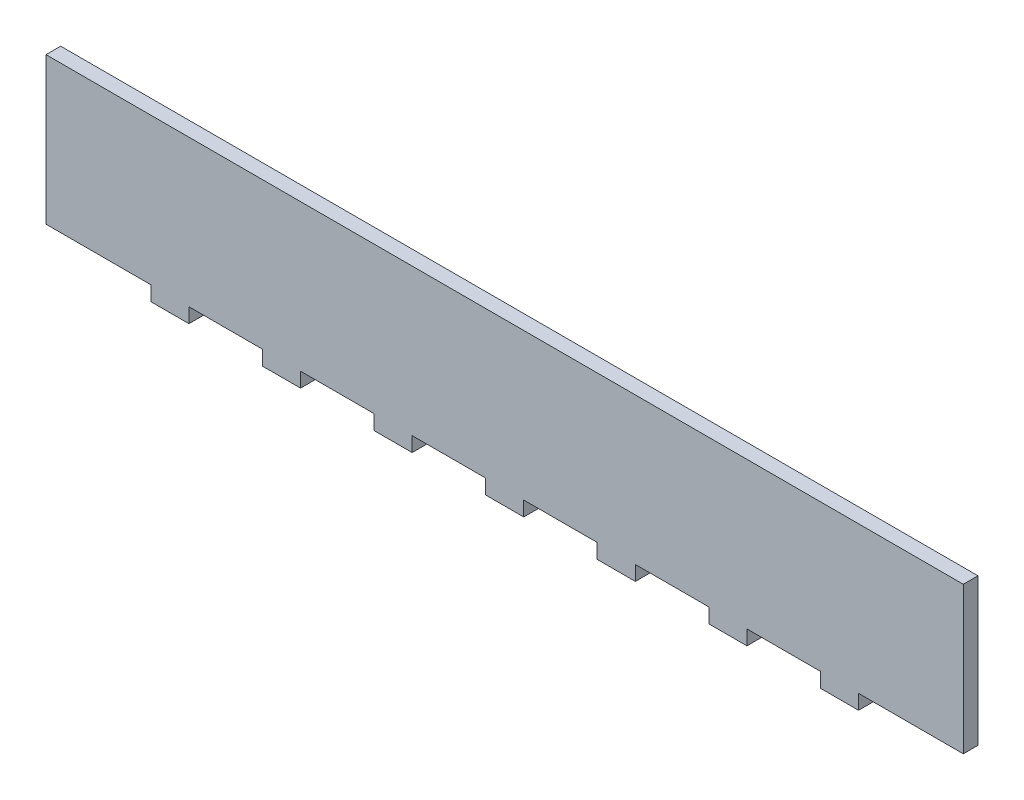
from build123d import *

# Parameters (mm, degrees)
SKETCH1_W            = 187.4
SKETCH1_H            = 30
BOSS_EXTRUDE1_DEPTH  = 3
SKETCH2_W            = 7.8
SKETCH2_H            = 3
BOSS_EXTRUDE2_DEPTH  = 3
LPATTERN2_COUNT      = 4
LPATTERN2_PITCH      = 22.8
LPATTERN2_COUNT_DIR2 = 4
LPATTERN2_PITCH_DIR2 = 22.8


with BuildPart() as part:
    # Sketch1 → Boss-Extrude1 (new body)
    with BuildSketch(Plane.XY):
        Rectangle(SKETCH1_W, SKETCH1_H)
    extrude(amount=BOSS_EXTRUDE1_DEPTH)

    # Sketch2 → Boss-Extrude2 (add)
    with BuildSketch(Plane.XZ.offset(15)):
        with Locations((0, 1.5)):
            Rectangle(SKETCH2_W, SKETCH2_H)
    boss_extrude2 = extrude(amount=BOSS_EXTRUDE2_DEPTH)

    # LPattern2: Boss-Extrude2 4 × 4
    with Locations(*[Vector(1, 0, 0) * (i * LPATTERN2_PITCH) + Vector(-1, 0, 0) * (j * LPATTERN2_PITCH_DIR2) for i in range(LPATTERN2_COUNT) for j in range(LPATTERN2_COUNT_DIR2) if (i, j) != (0, 0)]):
        add(boss_extrude2)


solid = part.part
